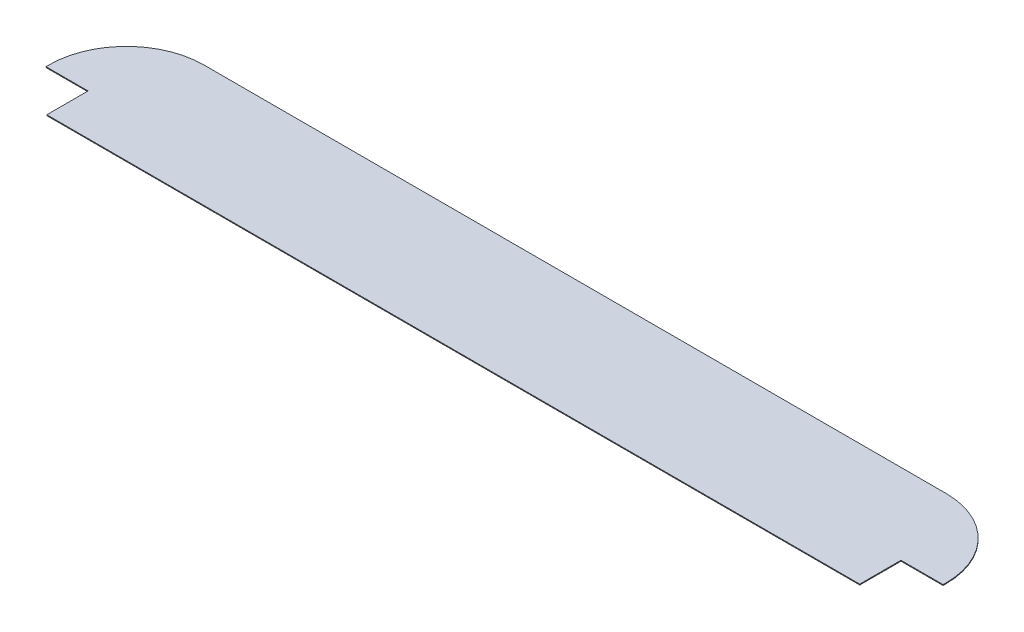
from build123d import *

# Parameters (mm, degrees)
BASE_FLANGE1_DEPTH = 0.8


# Sheet-metal steps are written as plain solids
with BuildPart() as part:
    # Sketch1 → Base-Flange1 (new body)
    with BuildSketch(Plane(origin=(0, 0, 0), x_dir=(1, 0, 0), z_dir=(0, 1, 0))):
        with BuildLine():
            Line((-455.05, -59), (333.35, -59))
            Line((333.35, -59), (333.35, -19))
            Line((333.35, -19), (374.15, -19))
            Line((374.15, -19), (374.15, -16))
            ThreePointArc((374.15, -16), (352.183008589, 37.033008589), (299.15, 59))
            Line((299.15, 59), (-420.85, 59))
            ThreePointArc((-420.85, 59), (-473.883008589, 37.033008589), (-495.85, -16))
            Line((-495.85, -16), (-495.85, -19))
            Line((-495.85, -19), (-455.05, -19))
            Line((-455.05, -19), (-455.05, -59))
        make_face()
    extrude(amount=-BASE_FLANGE1_DEPTH)


solid = part.part
